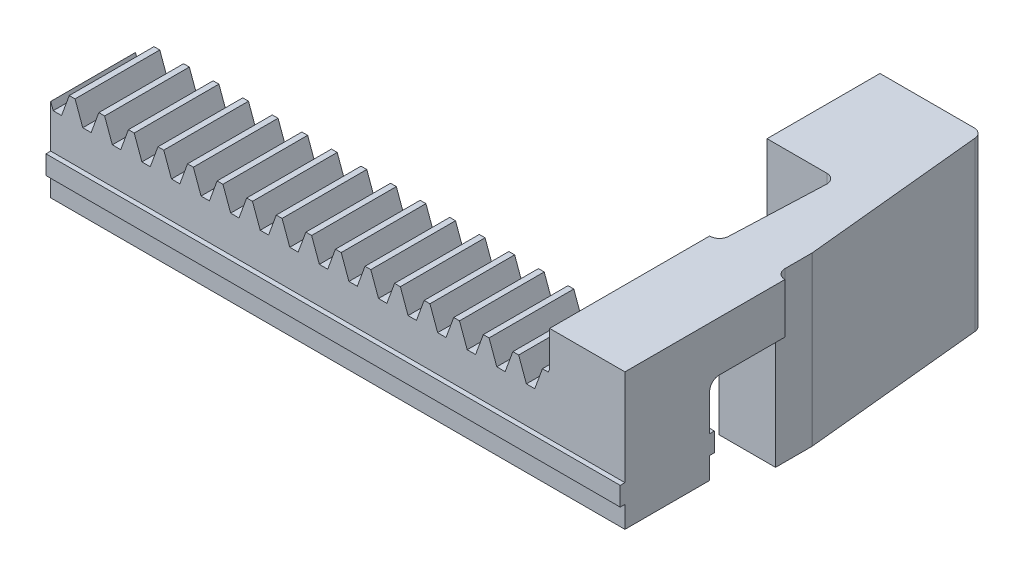
from build123d import *

# Parameters (mm, degrees)
BLANKSKE_W           = 68
BLANKSKE_H           = 9
BLANK_DEPTH          = 10
TOOTHCUTSIM_DEPTH    = 70.318107302
TEETHCUTS_COUNT      = 23
TEETHCUTS_PITCH      = 3.14159265
SKETCH1_W            = 10
SKETCH1_H            = 8.592466409
BOSS_EXTRUDE1_DEPTH  = 8
SKETCH3_W            = 8
SKETCH3_H            = 10
BOSS_EXTRUDE2_DEPTH  = 4.5
SKETCH4_W            = 8
SKETCH4_H            = 3.8
BOSS_EXTRUDE3_DEPTH  = 8
SKETCH5_W            = 10
SKETCH5_H            = 11.170580006
CUT_EXTRUDE1_DEPTH   = 8
CUT_EXTRUDE2_DEPTH   = 1
BOSS_EXTRUDE5_DEPTH  = 0.5
FILLET8_START        = -10
FILLET8_DEPTH        = 9
FILLET8_START_2      = -18
FILLET8_2_DEPTH      = 8.45342
BOSS_EXTRUDE6_DEPTH  = 17.79
BOSS_EXTRUDE10_DEPTH = 1.5
FILLET15_R           = 1
SKETCH11_W           = 15.24537785
SKETCH11_H           = 13.543744844
CUT_EXTRUDE3_DEPTH   = 7
SKETCH16_W           = 61
SKETCH16_H           = 9
BOSS_EXTRUDE12_DEPTH = 1.4
FILLET19_R           = 1


with BuildPart() as part:
    # BlankSke → Blank (new body)
    with BuildSketch(Plane.XY):
        with Locations((34, 4.5)):
            Rectangle(BLANKSKE_W, BLANKSKE_H)
    extrude(amount=-BLANK_DEPTH)

    # TooCutSkeSim → ToothCutSim (cut, through all)
    with BuildSketch(Plane.XY):
        Polygon((0.44443537, 6.75), (-0.44443537, 6.75), (-1.272613241, 9.0254), (1.272613241, 9.0254), align=None)
    toothcutsim = extrude(amount=-TOOTHCUTSIM_DEPTH, mode=Mode.SUBTRACT)

    # TeethCuts: ToothCutSim ×23
    with Locations(*[(i * TEETHCUTS_PITCH, 0, 0) for i in range(1, TEETHCUTS_COUNT)]):
        add(toothcutsim, mode=Mode.SUBTRACT)

    # Sketch1 → Boss-Extrude1 (add)
    with BuildSketch(Plane(origin=(68, 0, 0), x_dir=(0, 0, -1), z_dir=(1, 0, 0))):
        with Locations((5, 4.296233205)):
            Rectangle(SKETCH1_W, SKETCH1_H)
    extrude(amount=BOSS_EXTRUDE1_DEPTH)

    # Sketch3 → Boss-Extrude2 (add)
    with BuildSketch(Plane(origin=(0, 8.592466409, 0), x_dir=(1, 0, 0), z_dir=(0, 1, 0))):
        with Locations((72, 5)):
            Rectangle(SKETCH3_W, SKETCH3_H)
    extrude(amount=BOSS_EXTRUDE2_DEPTH)

    # Sketch4 → Boss-Extrude3 (add)
    with BuildSketch(Plane(origin=(0, 0, -10), x_dir=(-1, 0, 0), z_dir=(0, 0, -1))):
        with Locations((-72, 11.192466409)):
            Rectangle(SKETCH4_W, SKETCH4_H)
    extrude(amount=BOSS_EXTRUDE3_DEPTH)

    # Sketch5 → Cut-Extrude1 (cut)
    with BuildSketch(Plane.ZY):
        with Locations((-5, 5.585290003)):
            Rectangle(SKETCH5_W, SKETCH5_H)
    extrude(amount=-CUT_EXTRUDE1_DEPTH, mode=Mode.SUBTRACT)

    # Sketch6 → Cut-Extrude2 (cut)
    with BuildSketch(Plane.XY):
        Polygon((8.161409553, 9), (8, 9), (8, 0), (76, 0), (76, 13.092466409), (68, 13.092466409), (68, 8.592466409), (67.851669903, 9), (67.236814047, 9), (66.41788102, 6.75), (65.52901028, 6.75), (64.710077253, 9), (64.095221397, 9), (63.27628837, 6.75), (62.38741763, 6.75), (61.568484603, 9), (60.953628747, 9), (60.13469572, 6.75), (59.24582498, 6.75), (58.426891953, 9), (57.812036097, 9), (56.99310307, 6.75), (56.10423233, 6.75), (55.285299303, 9), (54.670443447, 9), (53.85151042, 6.75), (52.96263968, 6.75), (52.143706653, 9), (51.528850797, 9), (50.70991777, 6.75), (49.82104703, 6.75), (49.002114003, 9), (48.387258147, 9), (47.56832512, 6.75), (46.67945438, 6.75), (45.860521353, 9), (45.245665497, 9), (44.42673247, 6.75), (43.53786173, 6.75), (42.718928703, 9), (42.104072847, 9), (41.28513982, 6.75), (40.39626908, 6.75), (39.577336053, 9), (38.962480197, 9), (38.14354717, 6.75), (37.25467643, 6.75), (36.435743403, 9), (35.820887547, 9), (35.00195452, 6.75), (34.11308378, 6.75), (33.294150753, 9), (32.679294897, 9), (31.86036187, 6.75), (30.97149113, 6.75), (30.152558103, 9), (29.537702247, 9), (28.71876922, 6.75), (27.82989848, 6.75), (27.010965453, 9), (26.396109597, 9), (25.57717657, 6.75), (24.68830583, 6.75), (23.869372803, 9), (23.254516947, 9), (22.43558392, 6.75), (21.54671318, 6.75), (20.727780153, 9), (20.112924297, 9), (19.29399127, 6.75), (18.40512053, 6.75), (17.586187503, 9), (16.971331647, 9), (16.15239862, 6.75), (15.26352788, 6.75), (14.444594853, 9), (13.829738997, 9), (13.01080597, 6.75), (12.12193523, 6.75), (11.303002203, 9), (10.688146347, 9), (9.86921332, 6.75), (8.98034258, 6.75), align=None)
    extrude(amount=-CUT_EXTRUDE2_DEPTH, mode=Mode.SUBTRACT)

    # Sketch7 → Boss-Extrude5 (add)
    with BuildSketch(Plane.XY.offset(-1)):
        Polygon((8.8, 0.9), (75.2, 0.9), (76, 0.9), (76, 2.9), (75.2, 2.9), (8.8, 2.9), (8, 2.9), (8, 0.9), align=None)
    boss_extrude5 = extrude(amount=BOSS_EXTRUDE5_DEPTH)

    # Mirror3: Boss-Extrude5 across plane
    add(boss_extrude5.mirror(Plane.XY.offset(-5.5)))

    # Fillet8: read off the stored shape, not the designer's step
    # Fillet8 outline → Fillet8 (add)
    with BuildSketch(Plane.XY.offset(FILLET8_START)):
        with BuildLine():
            ThreePointArc((68, 9.524078597), (67.962203176, 9.251745991), (67.851669903, 9))
            Line((67.851669903, 9), (68, 8.592466409))
            Line((68, 8.592466409), (68, 9.524078597))
        make_face()
    extrude(amount=FILLET8_DEPTH)

    # Fillet8 2 outline → Fillet8 2 (add)
    with BuildSketch(Plane.XY.offset(FILLET8_START_2)):
        with BuildLine():
            Line((68, 9.292466409), (68, 9.524078597))
            ThreePointArc((68, 9.524078597), (67.993178786, 9.407477139), (67.9728082, 9.292466409))
            Line((67.9728082, 9.292466409), (68, 9.292466409))
        make_face()
    extrude(amount=FILLET8_2_DEPTH)

    # Sketch8 → Boss-Extrude6 (add)
    with BuildSketch(Plane(origin=(0, 13.092466409, 0), x_dir=(1, 0, 0), z_dir=(0, 1, 0))):
        with BuildLine():
            Line((75, 18), (75, 21.850371294))
            ThreePointArc((75, 21.850371294), (74.998770766, 21.899938995), (74.995086086, 21.949384835))
            Line((74.995086086, 21.949384835), (73.089650394, 41.099013541))
            ThreePointArc((73.089650394, 41.099013541), (72.765752232, 41.741287239), (72.094564308, 42))
            Line((72.094564308, 42), (62.094564308, 42))
            Line((62.094564308, 42), (62.094564308, 30))
            Line((62.094564308, 30), (64.933441114, 30))
            Line((64.933441114, 30), (68.447653948, 30))
            ThreePointArc((68.447653948, 30), (69.169019838, 29.692554151), (69.446823832, 28.959262504))
            Line((69.446823832, 28.959262504), (69, 18))
            Line((69, 18), (75, 18))
        make_face()
    extrude(amount=-BOSS_EXTRUDE6_DEPTH)

    # Sketch14 → Boss-Extrude10 (add)
    with BuildSketch(Plane.XZ.offset(-9.292466409)):
        Polygon((76, -10), (67.9728082, -10), (67.9728082, -18), (69, -18), (75, -18), (76, -18), align=None)
    extrude(amount=BOSS_EXTRUDE10_DEPTH)

    # Fillet15
    fillet15_edges = [part.edges().sort_by_distance(p)[0] for p in [
        (71.9864041, 7.792466409, -10),
        (72, 7.792466409, -18),
    ]]
    fillet(fillet15_edges, radius=FILLET15_R)

    # Sketch11 → Cut-Extrude3 (cut)
    with BuildSketch(Plane.ZY.offset(-8)):
        with Locations((-5.226368624, 3.937583059)):
            Rectangle(SKETCH11_W, SKETCH11_H)
    extrude(amount=-CUT_EXTRUDE3_DEPTH, mode=Mode.SUBTRACT)

    # Sketch16 → Boss-Extrude12 (add)
    with BuildSketch(Plane.XZ):
        with Locations((45.5, -5.5)):
            Rectangle(SKETCH16_W, SKETCH16_H)
    extrude(amount=BOSS_EXTRUDE12_DEPTH)

    # Fillet19
    fillet19_edges = [part.edges().sort_by_distance(p)[0] for p in [
        (75, 10.442466409, -18),
        (69, 10.442466409, -18),
    ]]
    fillet(fillet19_edges, radius=FILLET19_R - 0.0001)  # a hair under: the kernel refuses the full size


solid = part.part
